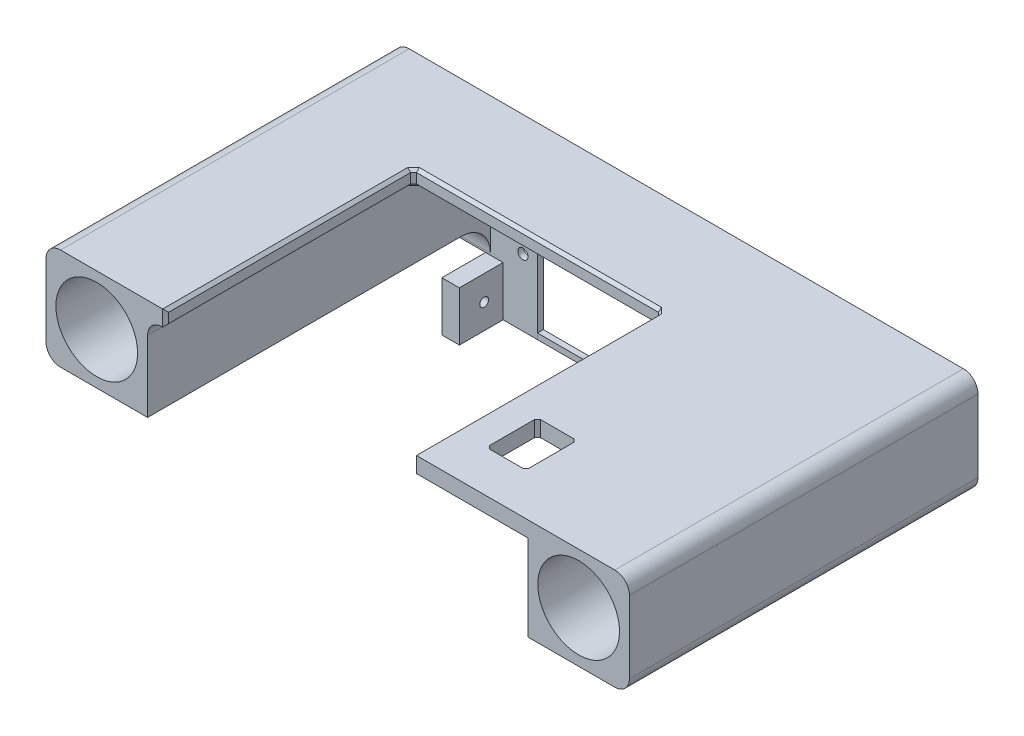
from build123d import *

# Parameters (mm, degrees)
SKETCH1_R            = 14
BOSS_EXTRUDE1_DEPTH  = 119.5
SKETCH5_W            = 85
SKETCH5_H            = 85
CUT_EXTRUDE2_DEPTH   = 10
CHAMFER2_SIZE        = 1
SKETCH6_W            = 15
SKETCH6_H            = 57
SKETCH6_W_2          = 51
SKETCH6_H_2          = 12
BOSS_EXTRUDE3_DEPTH  = 2
SKETCH7_R            = 1.75
CUT_EXTRUDE3_DEPTH   = 2
FILLET1_R            = 10
FILLET2_R            = 10
SKETCH8_W            = 13.5
SKETCH8_H            = 17.5
CUT_EXTRUDE4_DEPTH   = 10
CHAMFER4_SIZE        = 1
SKETCH10_W           = 9.140808063
SKETCH10_H           = 30.26858539
BOSS_EXTRUDE4_DEPTH  = 2
FILLET3_R            = 5
FILLET4_R            = 5
FILLET5_R            = 5
SKETCH11_W           = 40.67275181
SKETCH11_H           = 57
BOSS_EXTRUDE5_DEPTH  = 2
SKETCH13_W           = 35.5
SKETCH13_H           = 15
BOSS_EXTRUDE6_DEPTH  = 6
SKETCH14_W           = 2
SKETCH14_H           = 27.577394829
CUT_EXTRUDE5_DEPTH   = 17
SKETCH15_W           = 17.8
SKETCH15_H           = 17
BOSS_EXTRUDE7_DEPTH  = 2
SKETCH16_W           = 15
SKETCH16_H           = 17
BOSS_EXTRUDE8_DEPTH  = 6
FILLET6_R            = 2
SKETCH17_W           = 58.5
SKETCH17_H           = 2
BOSS_EXTRUDE9_DEPTH  = 2
SKETCH18_W           = 15
SKETCH18_H           = 19.468455061
BOSS_EXTRUDE10_DEPTH = 6
SKETCH19_R           = 1.5
CUT_EXTRUDE6_DEPTH   = 6
SKETCH21_R           = 1.5
CUT_EXTRUDE7_DEPTH   = 6
SKETCH22_R           = 1.5
CUT_EXTRUDE8_DEPTH   = 6


with BuildPart() as part:
    # Sketch1 → Boss-Extrude1 (new body)
    with BuildSketch(Plane.XY):
        Polygon((-50, 17.4), (-15.2, 17.4), (50, 17.4), (50, 12.022605171), (-15.17275181, 12.022605171), (-15.17275181, -17.4), (-50, -17.4), align=None)
        with Locations(Location((-32.6, 0, 0), (0, 0, 180))):
            Circle(SKETCH1_R, mode=Mode.SUBTRACT)
    boss_extrude1 = extrude(amount=BOSS_EXTRUDE1_DEPTH)

    # Mirror1: Boss-Extrude1 across plane
    add(boss_extrude1.mirror(Plane(origin=(50, 17.4, 119.5), x_dir=(0, 0, 1), z_dir=(-1, 0, 0))))

    # Sketch5 → Cut-Extrude2 (cut)
    with BuildSketch(Plane(origin=(0, 17.4, 0), x_dir=(1, 0, 0), z_dir=(0, 1, 0))):
        with Locations((33.5, -77)):
            Rectangle(SKETCH5_W, SKETCH5_H)
    extrude(amount=-CUT_EXTRUDE2_DEPTH, mode=Mode.SUBTRACT)

    # Chamfer2
    chamfer2_edges = [part.edges().sort_by_distance(p)[0] for p in [
        (-9, 12.022605171, 77),
        (-9, 14.711302586, 119.5),
        (33.5, 12.022605171, 34.5),
        (-9, 14.711302586, 34.5),
        (76, 12.022605171, 77),
        (76, 14.711302586, 34.5),
        (76, 14.711302586, 119.5),
        (-9, 17.4, 77),
        (76, 17.4, 77),
        (33.5, 17.4, 34.5),
    ]]
    chamfer(chamfer2_edges, length=CHAMFER2_SIZE)

    # Sketch6 → Boss-Extrude3 (add)
    with BuildSketch(Plane(origin=(0, 0, 0), x_dir=(-1, 0, 0), z_dir=(0, 0, -1))):
        with Locations((-67, -16.477394829)):
            Rectangle(SKETCH6_W, SKETCH6_H)
        with Locations((24.5, -21.977394829)):
            Rectangle(SKETCH6_W_2, SKETCH6_H_2)
    extrude(amount=-BOSS_EXTRUDE3_DEPTH)

    # Sketch7 → Cut-Extrude3 (cut)
    with BuildSketch(Plane(origin=(0, 0, 0), x_dir=(-1, 0, 0), z_dir=(0, 0, -1))):
        with Locations((4, -21.977394829)):
            Circle(SKETCH7_R)
        with Locations((-67, 7.022605171)):
            Circle(SKETCH7_R)
        with Locations((-67, -39.977394829)):
            Circle(SKETCH7_R)
    extrude(amount=-CUT_EXTRUDE3_DEPTH, mode=Mode.SUBTRACT)

    # Fillet1
    fillet1_edges = [part.edges().sort_by_distance(p)[0] for p in [
        (-32.586375905, -17.4, 2),
    ]]
    fillet(fillet1_edges, radius=FILLET1_R)

    # Fillet2
    fillet2_edges = [part.edges().sort_by_distance(p)[0] for p in [
        (59.5, 12.022605171, 1),
    ]]
    fillet(fillet2_edges, radius=FILLET2_R)

    # Sketch8 → Cut-Extrude4 (cut)
    with BuildSketch(Plane(origin=(0, 17.4, 0), x_dir=(1, 0, 0), z_dir=(0, 1, 0))):
        with Locations((93.315639073, -96.31798342)):
            Rectangle(SKETCH8_W, SKETCH8_H)
    extrude(amount=-CUT_EXTRUDE4_DEPTH, mode=Mode.SUBTRACT)

    # Chamfer4
    chamfer4_edges = [part.edges().sort_by_distance(p)[0] for p in [
        (86.565639073, 14.711302586, 105.06798342),
        (86.565639073, 14.711302586, 87.56798342),
        (100.065639073, 14.711302586, 87.56798342),
        (100.065639073, 14.711302586, 105.06798342),
    ]]
    chamfer(chamfer4_edges, length=CHAMFER4_SIZE)

    # Sketch10 → Boss-Extrude4 (add)
    with BuildSketch(Plane(origin=(0, 0, 0), x_dir=(-1, 0, 0), z_dir=(0, 0, -1))):
        with Locations((12.298347732, -2.03609998)):
            Rectangle(SKETCH10_W, SKETCH10_H)
    extrude(amount=-BOSS_EXTRUDE4_DEPTH)

    # Fillet3
    fillet3_edges = [part.edges().sort_by_distance(p)[0] for p in [
        (-7.7279437, -15.977394829, 1),
    ]]
    fillet(fillet3_edges, radius=FILLET3_R)

    # Fillet4
    fillet4_edges = [part.edges().sort_by_distance(p)[0] for p in [
        (-7.7279437, 12.022605171, 1),
    ]]
    fillet(fillet4_edges, radius=FILLET4_R)

    # Fillet5
    # the kernel refuses this fillet: 5 mm, written as the material it adds along each edge
    with BuildSketch(Plane(origin=(-15.17275181, 12.022605171, 2), x_dir=(0, -1, 0), z_dir=(0, 0, 1))) as fillet5_piece_1:
        with BuildLine():
            CenterArc((FILLET5_R, FILLET5_R), FILLET5_R, 180, 90)
            Line((0, FILLET5_R), (0, 0))
            Line((0, 0), (FILLET5_R, 0))
        make_face()
    extrude(amount=117.5)
    # the kernel refuses this fillet: 5 mm, written as the material it takes off along each edge
    with BuildSketch(Plane(origin=(150, 17.4, -12.5), x_dir=(-1, 0, 0), z_dir=(0, 0, 1)), Plane(origin=(150, -17.4, -12.5), x_dir=(0, 1, 0), z_dir=(0, 0, 1)), Plane(origin=(-50, 17.4, -12.5), x_dir=(0, -1, 0), z_dir=(0, 0, 1))) as fillet5_2_piece_1:
        with BuildLine():
            CenterArc((FILLET5_R, FILLET5_R), FILLET5_R, 180, 90)
            Line((0, FILLET5_R), (0, 0))
            Line((0, 0), (FILLET5_R, 0))
        make_face()
    extrude(amount=144.5, mode=Mode.SUBTRACT)
    with BuildSketch(Plane(origin=(-50, -27.4, 2), x_dir=(0, 0, -1), z_dir=(0, -1, 0))) as fillet5_2_piece_2:
        with BuildLine():
            CenterArc((FILLET5_R, FILLET5_R), FILLET5_R, 180, 90)
            Line((0, FILLET5_R), (0, 0))
            Line((0, 0), (FILLET5_R, 0))
        make_face()
    extrude(amount=13.077394829, mode=Mode.SUBTRACT)
    with BuildSketch(Plane(origin=(-50, -27.4, 12), x_dir=(0, 0, -1), z_dir=(0, -1, 0))) as fillet5_2_piece_3:
        with BuildLine():
            CenterArc((10 + FILLET5_R, FILLET5_R), FILLET5_R, 180, 90)
            Line((10, FILLET5_R), (10, 0))
            Line((10, 0), (10 + FILLET5_R, 0))
        make_face()
    revolve(axis=Axis((-50, -27.4, 12), (1, 0, 0)), revolution_arc=90, mode=Mode.SUBTRACT)
    with BuildSketch(Plane(origin=(-50, -17.4, 12), x_dir=(0, 1, 0), z_dir=(0, 0, 1))) as fillet5_2_piece_4:
        with BuildLine():
            CenterArc((FILLET5_R, -FILLET5_R), FILLET5_R, 90, 90)
            Line((0, -FILLET5_R), (0, 0))
            Line((0, 0), (FILLET5_R, 0))
        make_face()
    extrude(amount=120, mode=Mode.SUBTRACT)

    # Sketch11 → Boss-Extrude5 (add)
    with BuildSketch(Plane(origin=(0, 0, 0), x_dir=(-1, 0, 0), z_dir=(0, 0, -1))):
        with Locations((-94.836375905, -16.477394829)):
            Rectangle(SKETCH11_W, SKETCH11_H)
    extrude(amount=-BOSS_EXTRUDE5_DEPTH)

    # Sketch13 → Boss-Extrude6 (add)
    with BuildSketch(Plane(origin=(0, -44.977394829, 0), x_dir=(-1, 0, 0), z_dir=(0, -1, 0))):
        with Locations((-97.42275181, -9.5)):
            Rectangle(SKETCH13_W, SKETCH13_H)
    extrude(amount=-BOSS_EXTRUDE6_DEPTH)

    # Sketch14 → Cut-Extrude5 (cut)
    with BuildSketch(Plane(origin=(0, 0, 0), x_dir=(-1, 0, 0), z_dir=(0, 0, -1))):
        with Locations((-114.17275181, -31.188697415)):
            Rectangle(SKETCH14_W, SKETCH14_H)
    extrude(amount=-CUT_EXTRUDE5_DEPTH, mode=Mode.SUBTRACT)

    # Sketch15 → Boss-Extrude7 (add)
    with BuildSketch(Plane(origin=(0, 0, 0), x_dir=(-1, 0, 0), z_dir=(0, 0, -1))):
        with Locations((7.9, -36.477394829)):
            Rectangle(SKETCH15_W, SKETCH15_H)
    extrude(amount=-BOSS_EXTRUDE7_DEPTH)

    # Sketch16 → Boss-Extrude8 (add)
    with BuildSketch(Plane.ZY.offset(16.8)):
        with Locations((9.5, -36.477394829)):
            Rectangle(SKETCH16_W, SKETCH16_H)
    extrude(amount=-BOSS_EXTRUDE8_DEPTH)

    # Fillet6
    fillet6_edges = [part.edges().sort_by_distance(p)[0] for p in [
        (1, -15.977394829, 1),
    ]]
    fillet(fillet6_edges, radius=FILLET6_R)

    # Sketch18 → Boss-Extrude10 (add)
    with BuildSketch(Plane(origin=(113.17275181, 0, 0), x_dir=(0, 0, -1), z_dir=(1, 0, 0))):
        with Locations((-9.5, -29.243167299)):
            Rectangle(SKETCH18_W, SKETCH18_H)
    extrude(amount=-BOSS_EXTRUDE10_DEPTH)

    # Sketch19 → Cut-Extrude6 (cut)
    with BuildSketch(Plane(origin=(113.17275181, 0, 0), x_dir=(0, 0, -1), z_dir=(1, 0, 0))):
        with Locations((-8.5, -32.243167298)):
            Circle(SKETCH19_R)
    extrude(amount=-CUT_EXTRUDE6_DEPTH, mode=Mode.SUBTRACT)

    # Sketch21 → Cut-Extrude7 (cut)
    with BuildSketch(Plane.XZ.offset(44.977394829)):
        with Locations(Location((96.923969756, 8.5, 0), (0, 0, 270))):
            Circle(SKETCH21_R)
    extrude(amount=-CUT_EXTRUDE7_DEPTH, mode=Mode.SUBTRACT)

    # Sketch22 → Cut-Extrude8 (cut)
    with BuildSketch(Plane.ZY.offset(16.8)):
        with Locations(Location((8.5, -36.477394829, 0), (0, 0, 270))):
            Circle(SKETCH22_R)
    extrude(amount=-CUT_EXTRUDE8_DEPTH, mode=Mode.SUBTRACT)


with BuildPart() as body_2:
    # Sketch17 → Boss-Extrude9 (new body)
    with BuildSketch(Plane(origin=(0, 0, 0), x_dir=(-1, 0, 0), z_dir=(0, 0, -1))):
        with Locations((-30.25, -43.977394829)):
            Rectangle(SKETCH17_W, SKETCH17_H)
    extrude(amount=-BOSS_EXTRUDE9_DEPTH)


solid = Compound([part.part, body_2.part])
